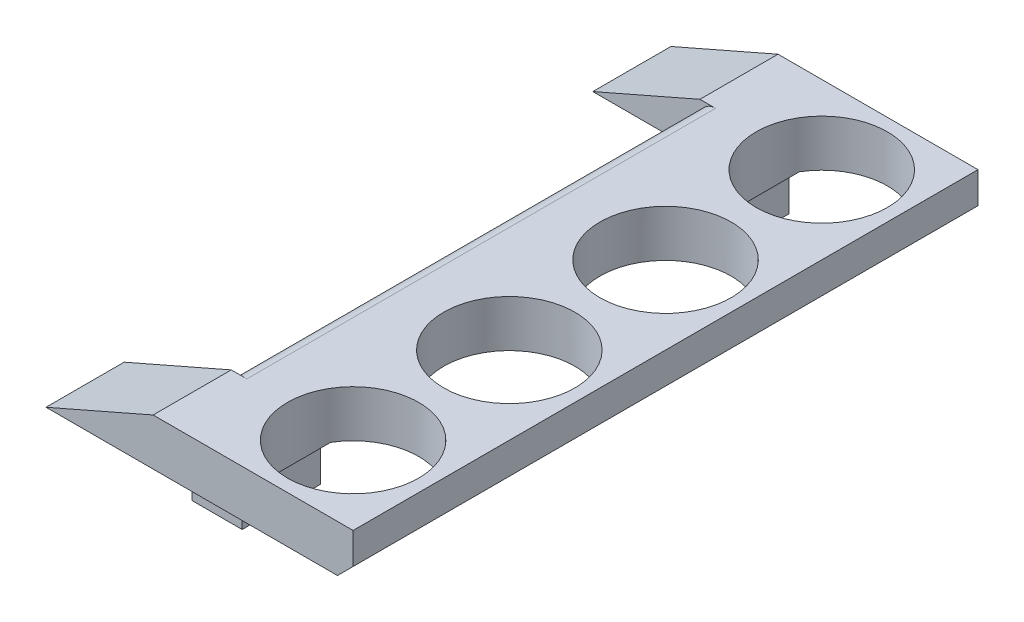
from build123d import *

# Parameters (mm, degrees)
EXTRUDE_1_DEPTH     = 15
SKETCH_3_3_W        = 35
SKETCH_3_3_H        = 25
EXTRUDE_2_DEPTH     = 15
CUT_EXTRUDE_1_DEPTH = 245
SKETCH_7_R          = 21
CUT_EXTRUDE_2_DEPTH = 15
SKETCH_8_R          = 5
CUT_EXTRUDE_4_DEPTH = 10
EXTRUDE_START       = 15
SKETCH_8_5_W        = 16
SKETCH_8_5_H        = 25
SKETCH_8_5_R        = 5
EXTRUDE_4_DEPTH     = 15
CHAMFER_1_SIZE      = 5
FILLET_1_R          = 5
CHAMFER_2_SIZE      = 5


with BuildPart() as part:
    # Эскиз3 → Бобышка-Вытянуть1 (new body)
    with BuildSketch(Plane(origin=(0, 0, 0), x_dir=(1, 0, 0), z_dir=(0, 1, 0))):
        Polygon((-32, -75), (-32, 75), (-32, 100), (32, 100), (32, -100), (-32, -100), align=None)
    extrude(amount=EXTRUDE_1_DEPTH)

    # Эскиз3<3> → Бобышка-Вытянуть2 (add)
    with BuildSketch(Plane(origin=(0, 0, 0), x_dir=(1, 0, 0), z_dir=(0, 1, 0))):
        with Locations((-49.5, 87.5)):
            Rectangle(SKETCH_3_3_W, SKETCH_3_3_H)
        with Locations((-49.5, -87.5)):
            Rectangle(SKETCH_3_3_W, SKETCH_3_3_H)
    extrude(amount=EXTRUDE_2_DEPTH)

    # Эскиз6 → Вырез-Вытянуть1 (cut)
    with BuildSketch(Plane.XY.offset(110)):
        Polygon((-67, 15), (-32, 15), (-67, -0.312590504), align=None)
    extrude(amount=-CUT_EXTRUDE_1_DEPTH, mode=Mode.SUBTRACT)

    # Эскиз7 → Вырез-Вытянуть2 (cut)
    with BuildSketch(Plane(origin=(0, 15, 0), x_dir=(1, 0, 0), z_dir=(0, 1, 0))):
        with Locations(Location((7, 75, 0), (0, 0, 270))):
            Circle(SKETCH_7_R)
        with Locations(Location((7, 25, 0), (0, 0, 270))):
            Circle(SKETCH_7_R)
        with Locations(Location((7, -25, 0), (0, 0, 270))):
            Circle(SKETCH_7_R)
        with Locations(Location((7, -75, 0), (0, 0, 270))):
            Circle(SKETCH_7_R)
    extrude(amount=-CUT_EXTRUDE_2_DEPTH, mode=Mode.SUBTRACT)

    # Эскиз8 → Вырез-Вытянуть4 (cut)
    with BuildSketch(Plane(origin=(0, 0, 0), x_dir=(-1, 0, 0), z_dir=(0, -1, 0))):
        with Locations(Location((23, 75, 0), (0, 0, 90))):
            Circle(SKETCH_8_R)
        with Locations(Location((23, -75, 0), (0, 0, 90))):
            Circle(SKETCH_8_R)
    extrude(amount=-CUT_EXTRUDE_4_DEPTH, mode=Mode.SUBTRACT)

    # Эскиз8<5> → Бобышка-Вытянуть4 (add)
    # profile 1 of 2: a face of its own
    with BuildSketch(Plane(origin=(0, 0, 0), x_dir=(-1, 0, 0), z_dir=(0, -1, 0)).offset(EXTRUDE_START)):
        with Locations((24, 75)):
            Rectangle(SKETCH_8_5_W, SKETCH_8_5_H)
        with Locations(Location((23, 75, 0), (0, 0, 90))):
            Circle(SKETCH_8_5_R, mode=Mode.SUBTRACT)
    # profile 2 of 2: a face of its own
    with BuildSketch(Plane(origin=(0, 0, 0), x_dir=(-1, 0, 0), z_dir=(0, -1, 0)).offset(EXTRUDE_START)):
        with Locations((24, -75)):
            Rectangle(SKETCH_8_5_W, SKETCH_8_5_H)
        with Locations(Location((23, -75, 0), (0, 0, 90))):
            Circle(SKETCH_8_5_R, mode=Mode.SUBTRACT)
    extrude(amount=-EXTRUDE_4_DEPTH)

    # Фаска1
    # the kernel refuses this chamfer: 5 mm, written as the material it takes off along each edge
    with BuildSketch(Plane(origin=(32, 0, -112.85841494), x_dir=(0.027495876610586317, 0.9996219169112968, 0), z_dir=(0, 0, 1))) as chamfer_1_piece_1:
        Polygon((CHAMFER_1_SIZE * 0.999621916911, CHAMFER_1_SIZE * 0.0274958766106), (-CHAMFER_1_SIZE * 0.0274958766106, CHAMFER_1_SIZE * 0.999621916911), (0, 0), align=None)
    extrude(amount=225.71682988, mode=Mode.SUBTRACT)

    # Скругление1
    fillet_1_edges = [part.edges().sort_by_distance(p)[0] for p in [
        (-32, 15, 0),
    ]]
    fillet(fillet_1_edges, radius=FILLET_1_R)

    # Фаска2
    # the kernel refuses this chamfer: 5 mm, written as the material it adds along each edge
    with BuildSketch(Plane(origin=(-16, 0, 87.5), x_dir=(0.9996219169112968, 0.027495876610586372, 0), z_dir=(0, 0, -1))) as chamfer_2_piece_1_section:
        Polygon((CHAMFER_2_SIZE * 0.999621916911, CHAMFER_2_SIZE * 0.0274958766106), (-CHAMFER_2_SIZE * 0.0274958766106, CHAMFER_2_SIZE * 0.999621916911), (0, 0), align=None)
    chamfer_2_piece_1 = extrude(amount=25, mode=Mode.PRIVATE)
    chamfer_2_piece_1 = chamfer_2_piece_1 - Plane(origin=(7, -1.841726954, 75), x_dir=(0, 0, 1), z_dir=(0, 1, 0)) * Cylinder(21, 70, mode=Mode.PRIVATE)
    add(chamfer_2_piece_1)
    with BuildSketch(Plane(origin=(-16, 0, -62.5), x_dir=(0.9996219169112968, 0.027495876610586372, 0), z_dir=(0, 0, -1))) as chamfer_2_piece_2_section:
        Polygon((CHAMFER_2_SIZE * 0.999621916911, CHAMFER_2_SIZE * 0.0274958766106), (-CHAMFER_2_SIZE * 0.0274958766106, CHAMFER_2_SIZE * 0.999621916911), (0, 0), align=None)
    chamfer_2_piece_2 = extrude(amount=25, mode=Mode.PRIVATE)
    chamfer_2_piece_2 = chamfer_2_piece_2 - Plane(origin=(7, -1.841726954, -75), x_dir=(0, 0, 1), z_dir=(0, 1, 0)) * Cylinder(21, 70, mode=Mode.PRIVATE)
    add(chamfer_2_piece_2)


solid = part.part
